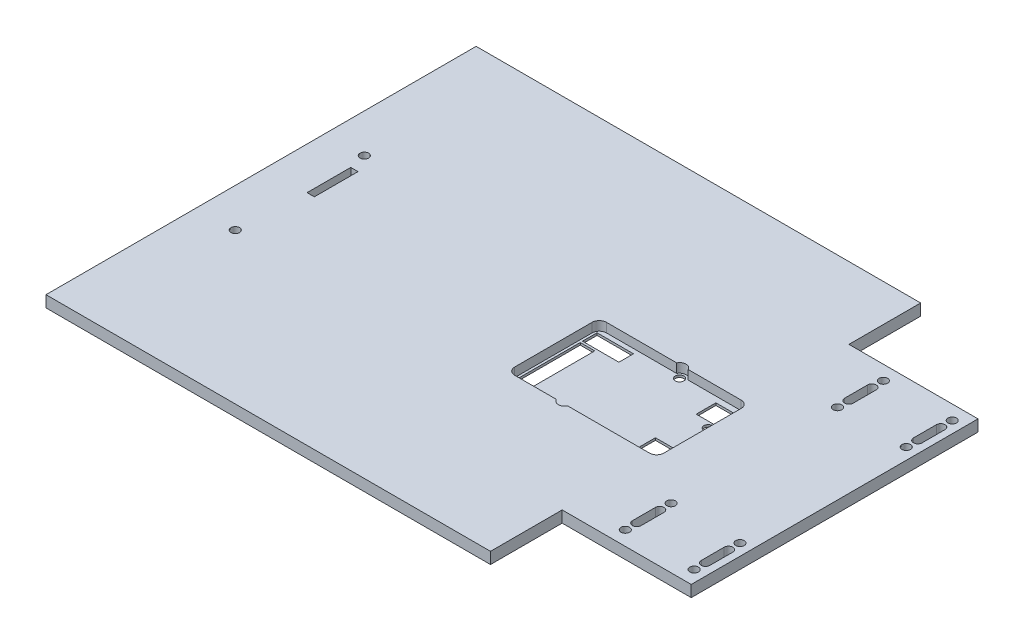
from build123d import *

# Parameters (mm, degrees)
SKETCH_1_W             = 200
SKETCH_1_H             = 150
EXTRUDE_1196_DEPTH     = 4
SKETCH_1250_R          = 1.5
SKETCH_1250_W          = 12.7
SKETCH_1250_H          = 5.08
SKETCH_1250_W_2        = 5.08
SKETCH_1250_H_2        = 22.86
SKETCH_1250_W_3        = 7.874
SKETCH_1250_H_3        = 6.858
DMOTOR_DEPTH           = 3.2
DMOTOR_2_OUTLINE_R     = 1.5
DMOTOR_2_OUTLINE_W     = 7.874
DMOTOR_2_OUTLINE_H     = 6.858
DMOTOR_2_OUTLINE_W_2   = 12.7
DMOTOR_2_OUTLINE_H_2   = 5.08
DMOTOR_2_OUTLINE_W_3   = 5.08
DMOTOR_2_OUTLINE_H_3   = 22.86
DMOTOR_2_DEPTH         = 4
LINELANCE_2_R          = 1.5
LINELANCE_2_W          = 2.54
LINELANCE_2_H          = 15.24
LINELANCE_DEPTH        = 126.063983624
SKETCH_3356_R          = 1.5
SKETCH_3356_W          = 45
SKETCH_3356_H          = 25
CUT_EXTRUDE_4137_DEPTH = 126.063983624


# Read off the part's stored shape, not the designer's step: Вырез для компонентов DMotor
with BuildPart() as part:
    # Эскиз1 → Extrude 1196 (new body)
    with BuildSketch(Plane(origin=(0, 0, 0), x_dir=(1, 0, 0), z_dir=(0, 1, 0))):
        Rectangle(SKETCH_1_W, SKETCH_1_H)
    extrude(amount=EXTRUDE_1196_DEPTH)

    # Sketch 1250 → DMotor (cut)
    with BuildSketch(Plane(origin=(0, 4, 0), x_dir=(1, 0, 0), z_dir=(0, 1, 0))):
        with BuildLine():
            Line((30.543559349, 14.375593505), (6.059123786, 14.375593505))
            ThreePointArc((6.059123786, 14.375593505), (4.291356833, 13.643360458), (3.559123786, 11.875593505))
            Line((3.559123786, 11.875593505), (3.559123786, -15.124406495))
            ThreePointArc((3.559123786, -15.124406495), (4.291356833, -16.892173448), (6.059123786, -17.624406495))
            Line((6.059123786, -17.624406495), (20.543559349, -17.624406495))
            ThreePointArc((20.543559349, -17.624406495), (22.559123786, -18.874406495), (24.574688223, -17.624406495))
            Line((24.574688223, -17.624406495), (53.059123786, -17.624406495))
            ThreePointArc((53.059123786, -17.624406495), (54.826890739, -16.892173448), (55.559123786, -15.124406495))
            Line((55.559123786, -15.124406495), (55.559123786, 11.875593505))
            ThreePointArc((55.559123786, 11.875593505), (54.826890739, 13.643360458), (53.059123786, 14.375593505))
            Line((53.059123786, 14.375593505), (34.574688223, 14.375593505))
            ThreePointArc((34.574688223, 14.375593505), (32.559123786, 15.625593505), (30.543559349, 14.375593505))
        make_face()
        with Locations(Location((22.559123786, -16.624406495, 0), (0, 0, 270))):
            Circle(SKETCH_1250_R, mode=Mode.SUBTRACT)
        with Locations(Location((32.559123786, 13.375593505, 0), (0, 0, 270))):
            Circle(SKETCH_1250_R, mode=Mode.SUBTRACT)
        with Locations(Location((52.559123786, 3.375593505, 0), (0, 0, 270))):
            Circle(SKETCH_1250_R, mode=Mode.SUBTRACT)
        with Locations((10.734123786, 10.235593505)):
            Rectangle(SKETCH_1250_W, SKETCH_1250_H, mode=Mode.SUBTRACT)
        with Locations((6.924123786, -4.509406495)):
            Rectangle(SKETCH_1250_W_2, SKETCH_1250_H_2, mode=Mode.SUBTRACT)
        with Locations((50.191123786, 8.914593505)):
            Rectangle(SKETCH_1250_W_3, SKETCH_1250_H_3, mode=Mode.SUBTRACT)
        with Locations((50.191123786, -12.163406495)):
            Rectangle(SKETCH_1250_W_3, SKETCH_1250_H_3, mode=Mode.SUBTRACT)
    extrude(amount=-DMOTOR_DEPTH, mode=Mode.SUBTRACT)

    # DMotor 2 outline → DMotor 2 (cut)
    with BuildSketch(Plane(origin=(0, 0, 0), x_dir=(1, 0, 0), z_dir=(0, 1, 0))):
        with Locations((32.559123786, 13.375593505)):
            Circle(DMOTOR_2_OUTLINE_R)
        with Locations((50.191123786, -12.163406495)):
            Rectangle(DMOTOR_2_OUTLINE_W, DMOTOR_2_OUTLINE_H)
        with Locations((50.191123786, 8.914593505)):
            Rectangle(DMOTOR_2_OUTLINE_W, DMOTOR_2_OUTLINE_H)
        with Locations((10.734123786, 10.235593505)):
            Rectangle(DMOTOR_2_OUTLINE_W_2, DMOTOR_2_OUTLINE_H_2)
        with Locations((6.924123786, -4.509406495)):
            Rectangle(DMOTOR_2_OUTLINE_W_3, DMOTOR_2_OUTLINE_H_3)
        with Locations((22.559123786, -16.624406495)):
            Circle(DMOTOR_2_OUTLINE_R)
        with Locations((52.559123786, 3.375593505)):
            Circle(DMOTOR_2_OUTLINE_R)
    extrude(amount=DMOTOR_2_DEPTH, mode=Mode.SUBTRACT)

    # Linelance 2 → Linelance (cut, through all)
    with BuildSketch(Plane(origin=(0, 4, 0), x_dir=(1, 0, 0), z_dir=(0, 1, 0))):
        with Locations(Location((-86.5, 22.5, 0), (0, 0, 270))):
            Circle(LINELANCE_2_R)
        with Locations(Location((-86.5, -22.5, 0), (0, 0, 270))):
            Circle(LINELANCE_2_R)
        with Locations((-84.03, 8.955)):
            Rectangle(LINELANCE_2_W, LINELANCE_2_H)
    extrude(amount=-LINELANCE_DEPTH, mode=Mode.SUBTRACT)

    # Sketch 3356 → Cut-Extrude 4137 (cut, through all)
    with BuildSketch(Plane(origin=(0, 4, 0), x_dir=(1, 0, 0), z_dir=(0, 1, 0))):
        with Locations(Location((72, 45, 0), (0, 0, 270))):
            Circle(SKETCH_3356_R)
        with Locations(Location((72, 29, 0), (0, 0, 270))):
            Circle(SKETCH_3356_R)
        with Locations(Location((96, 45, 0), (0, 0, 270))):
            Circle(SKETCH_3356_R)
        with Locations(Location((96, 29, 0), (0, 0, 270))):
            Circle(SKETCH_3356_R)
        with Locations(Location((96, -29, 0), (0, 0, 90))):
            Circle(SKETCH_3356_R)
        with Locations(Location((96, -45, 0), (0, 0, 90))):
            Circle(SKETCH_3356_R)
        with Locations(Location((72, -29, 0), (0, 0, 90))):
            Circle(SKETCH_3356_R)
        with Locations(Location((72, -45, 0), (0, 0, 90))):
            Circle(SKETCH_3356_R)
        with Locations((77.5, 62.5)):
            Rectangle(SKETCH_3356_W, SKETCH_3356_H)
        with Locations((77.5, -62.5)):
            Rectangle(SKETCH_3356_W, SKETCH_3356_H)
        with BuildLine():
            Line((73.5, 41), (73.5, 33))
            ThreePointArc((73.5, 33), (72, 31.5), (70.5, 33))
            Line((70.5, 33), (70.5, 41))
            ThreePointArc((70.5, 41), (72, 42.5), (73.5, 41))
        make_face()
        with BuildLine():
            Line((97.5, 41), (97.5, 33))
            ThreePointArc((97.5, 33), (96, 31.5), (94.5, 33))
            Line((94.5, 33), (94.5, 41))
            ThreePointArc((94.5, 41), (96, 42.5), (97.5, 41))
        make_face()
        with BuildLine():
            Line((73.5, -41), (73.5, -33))
            ThreePointArc((73.5, -33), (72, -31.5), (70.5, -33))
            Line((70.5, -33), (70.5, -41))
            ThreePointArc((70.5, -41), (72, -42.5), (73.5, -41))
        make_face()
        with BuildLine():
            Line((97.5, -41), (97.5, -33))
            ThreePointArc((97.5, -33), (96, -31.5), (94.5, -33))
            Line((94.5, -33), (94.5, -41))
            ThreePointArc((94.5, -41), (96, -42.5), (97.5, -41))
        make_face()
    extrude(amount=-CUT_EXTRUDE_4137_DEPTH, mode=Mode.SUBTRACT)


solid = part.part
